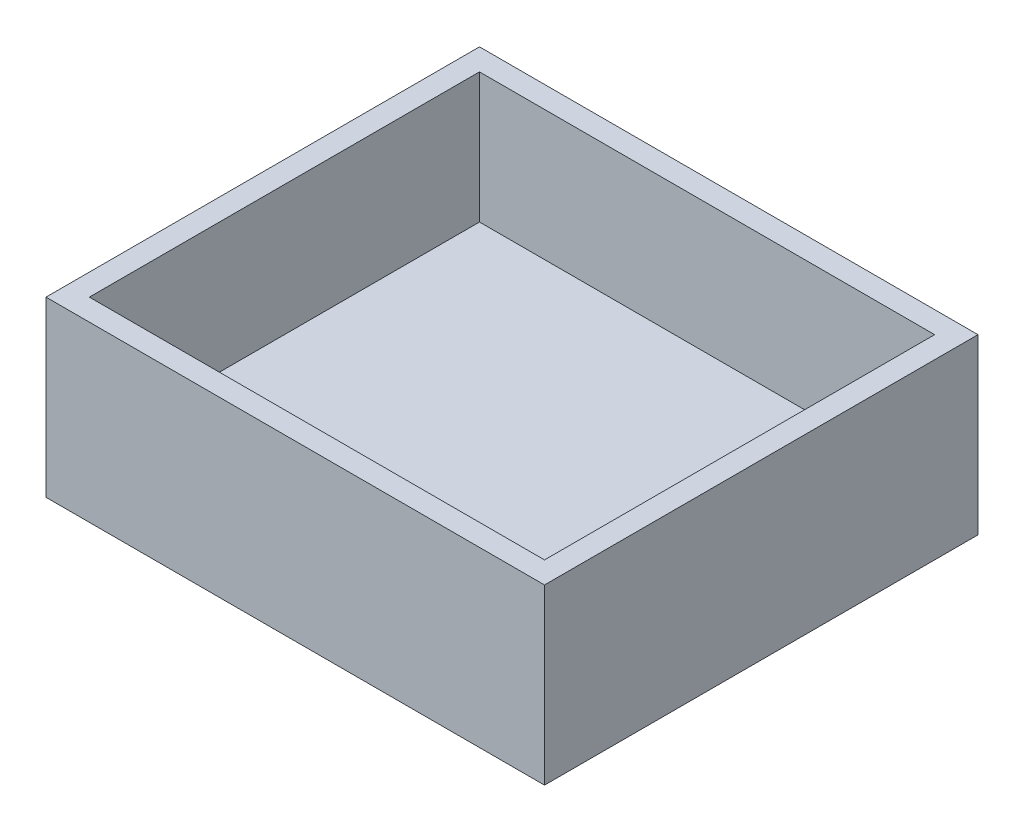
from build123d import *

# Parameters (mm, degrees)
SKETCH2_W           = 10.5
SKETCH2_H           = 9
BOSS_EXTRUDE2_DEPTH = 1
SKETCH2_3_W         = 11.5
SKETCH2_3_H         = 10
SKETCH2_3_W_2       = 10.5
SKETCH2_3_H_2       = 9
BOSS_EXTRUDE3_DEPTH = 4


with BuildPart() as part:
    # Sketch2 → Boss-Extrude2 (new body)
    with BuildSketch(Plane(origin=(0, 0, 0), x_dir=(1, 0, 0), z_dir=(0, 1, 0))):
        with Locations((5.75, 5)):
            Rectangle(SKETCH2_W, SKETCH2_H)
    extrude(amount=BOSS_EXTRUDE2_DEPTH)

    # Sketch2<3> → Boss-Extrude3 (add)
    with BuildSketch(Plane(origin=(0, 0, 0), x_dir=(1, 0, 0), z_dir=(0, 1, 0))):
        with Locations((5.75, 5)):
            Rectangle(SKETCH2_3_W, SKETCH2_3_H)
        with Locations((5.75, 5)):
            Rectangle(SKETCH2_3_W_2, SKETCH2_3_H_2, mode=Mode.SUBTRACT)
    extrude(amount=BOSS_EXTRUDE3_DEPTH)


solid = part.part
